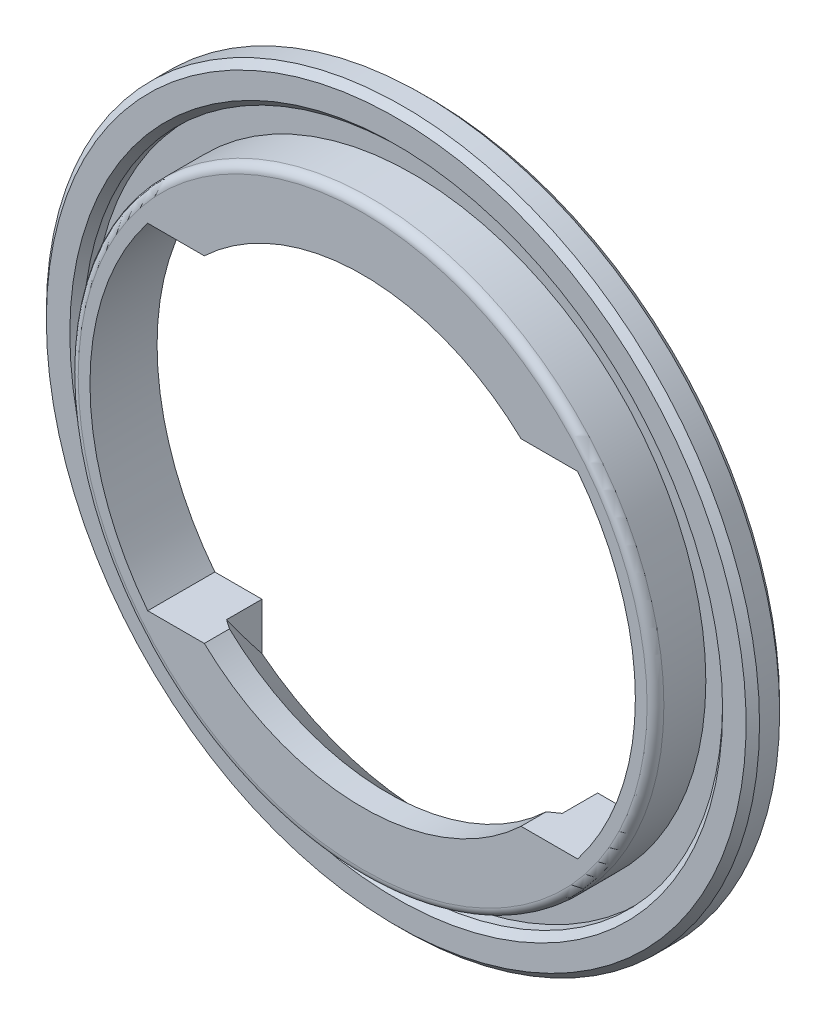
from build123d import *

# Parameters (mm, degrees)
FASE1_SIZE                      = 0.8
SCHNITT_LINEAR_AUSTRAGEN1_DEPTH = 10
SCHNITT_LINEAR_START            = -5
SCHNITT_LINEAR_AUSTRAGEN2_DEPTH = 5
FASE2_SIZE                      = 5
VERRUNDUNG1_R                   = 1


# Read off the part's stored shape, not the designer's step: Schnitt-Linear austragen2
with BuildPart() as part:
    # Skizze3 → Rotation1 (revolve)
    with BuildSketch(Plane(origin=(0, 0, 0), x_dir=(0, 0, -1), z_dir=(1, 0, 0)), mode=Mode.PRIVATE) as rotation1_sk:
        Polygon((0, 27.5), (0, 34.9), (6, 34.9), (6, 38.1), (4, 38.1), (4, 42.5), (8, 42.5), (8, 27.5), align=None)
    revolve(rotation1_sk.sketch.rotate(Axis((0, 0, 28.082191781), (0, 0, -1)), 90), axis=Axis((0, 0, 28.082191781), (0, 0, -1)))

    # Fase1
    fase1_edges = [part.edges().sort_by_distance(p)[0] for p in [
        (-27.5, 0, -8),
        (-42.5, 0, -8),
        (-42.5, 0, -4),
        (-38.1, 0, -4),
    ]]
    chamfer(fase1_edges, length=FASE1_SIZE)

    # Skizze4 → Schnitt-Linear austragen1 (cut)
    with BuildSketch(Plane.XY):
        with BuildLine():
            Line((25.617376915, 20), (-25.617376915, 20))
            ThreePointArc((-25.617376915, 20), (-30.731211738, 10.575567367), (-32.5, 0))
            Line((-32.5, 0), (32.5, 0))
            ThreePointArc((32.5, 0), (30.731211738, 10.575567367), (25.617376915, 20))
        make_face()
        with BuildLine():
            Line((32.5, 0), (-32.5, 0))
            ThreePointArc((-32.5, 0), (-30.731211738, -10.575567367), (-25.617376915, -20))
            Line((-25.617376915, -20), (25.617376915, -20))
            ThreePointArc((25.617376915, -20), (30.731211738, -10.575567367), (32.5, 0))
        make_face()
    extrude(amount=-SCHNITT_LINEAR_AUSTRAGEN1_DEPTH, mode=Mode.SUBTRACT)

    # Schnitt-Linear austragen2 outline → Schnitt-Linear austragen2 (cut)
    with BuildSketch(Plane(origin=(0, 0, -8), x_dir=(-1, 0, 0), z_dir=(0, 0, -1)).offset(SCHNITT_LINEAR_START)):
        with BuildLine():
            Line((-20, -20), (-20, -25.617376915))
            ThreePointArc((-20, -25.617376915), (0, -32.5), (20, -25.617376915))
            Line((20, -25.617376915), (20, -20))
            Line((20, -20), (18.874586088, -20))
            ThreePointArc((18.874586088, -20), (0, -27.5), (-18.874586088, -20))
            Line((-18.874586088, -20), (-20, -20))
        make_face()
        with BuildLine():
            Line((20, 20), (20, 25.617376915))
            ThreePointArc((20, 25.617376915), (0, 32.5), (-20, 25.617376915))
            Line((-20, 25.617376915), (-20, 20))
            Line((-20, 20), (-18.874586088, 20))
            ThreePointArc((-18.874586088, 20), (0, 27.5), (18.874586088, 20))
            Line((18.874586088, 20), (20, 20))
        make_face()
    extrude(amount=SCHNITT_LINEAR_AUSTRAGEN2_DEPTH, mode=Mode.SUBTRACT)

    # Fase2
    fase2_edges = [part.edges().sort_by_distance(p)[0] for p in [
        (0, -32.5, -3),
        (0, 32.5, -3),
    ]]
    chamfer(fase2_edges, length=FASE2_SIZE - 0.0001)  # a hair under: the kernel refuses the full size

    # Verrundung1
    verrundung1_edges = [part.edges().sort_by_distance(p)[0] for p in [
        (-34.9, 0, 0),
    ]]
    fillet(verrundung1_edges, radius=VERRUNDUNG1_R)


solid = part.part
